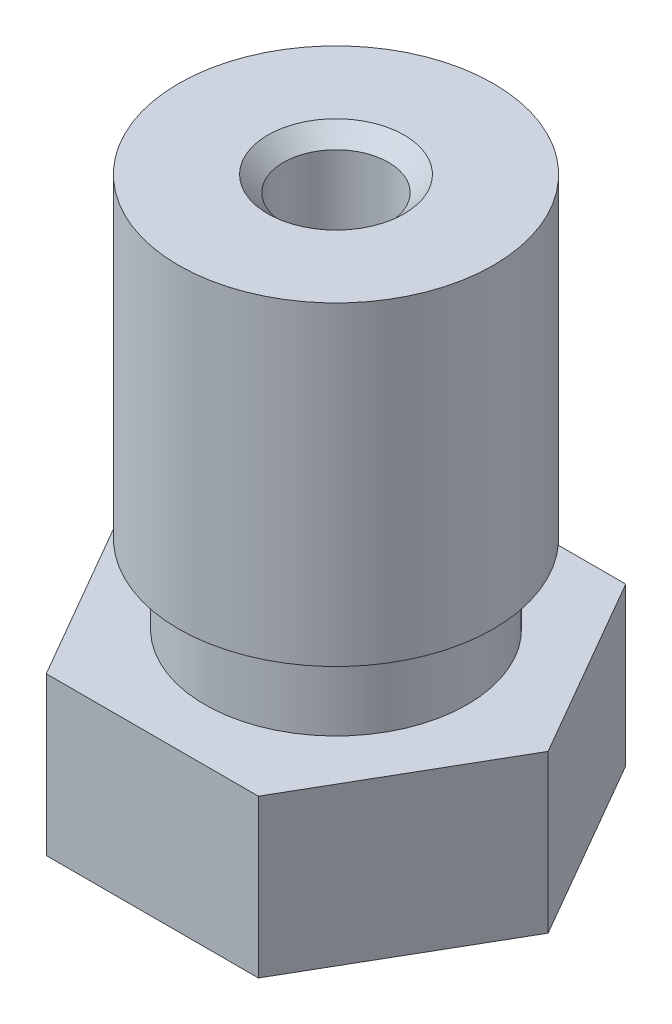
from build123d import *

# Parameters (mm, degrees)
BOSS_EXTRUDE1_START = -3
BOSS_EXTRUDE1_DEPTH = 3


with BuildPart() as part:
    # Sketch1 → Revolve1 (revolve)
    with BuildSketch(Plane.XY):
        Polygon((0, 0), (0.5, 0), (1.900415076, 2), (3.5, 2), (3.5, 5), (2.5, 5), (2.5, 6.5), (3, 6.5), (3, 12.5), (0, 12.5), align=None)
    revolve(axis=Axis((0, -1.1291331, 0), (0, -1, 0)))

    # Sketch2 → Cut-Revolve1 (revolve, cut)
    with BuildSketch(Plane.XY):
        Polygon((0, 12.5), (1.3, 12.5), (1, 12.2), (1, 1.985640646), (0.2, 0.6), (0.2, 0), (0, 0), align=None)
    revolve(axis=Axis((0, 0, 0), (0, 1, 0)), mode=Mode.SUBTRACT)

    # Sketch3 → Boss-Extrude1 (add)
    with BuildSketch(Plane.XZ.offset(-2).offset(BOSS_EXTRUDE1_START)):
        with BuildLine():
            Line((3.031088915, -1.749999996), (4.041451884, 0))
            Line((4.041451884, 0), (3.031088922, 1.749999985))
            ThreePointArc((3.031088922, 1.749999985), (3.5, -6e-09), (3.031088915, -1.749999996))
        make_face()
        with BuildLine():
            ThreePointArc((0, 3.5), (1.750000007, 3.031088909), (3.031088922, 1.749999985))
            Line((3.031088922, 1.749999985), (2.020725942, 3.5))
            Line((2.020725942, 3.5), (0, 3.5))
        make_face()
        with BuildLine():
            Line((2.020725942, -3.5), (3.031088915, -1.749999996))
            ThreePointArc((3.031088915, -1.749999996), (1.750000009, -3.031088908), (1.6e-08, -3.5))
            Line((1.6e-08, -3.5), (2.020725942, -3.5))
        make_face()
        with BuildLine():
            ThreePointArc((-3.031088921, 1.749999986), (-1.750000007, 3.031088909), (0, 3.5))
            Line((0, 3.5), (-2.020725942, 3.5))
            Line((-2.020725942, 3.5), (-3.031088921, 1.749999986))
        make_face()
        with BuildLine():
            Line((-2.020725942, -3.5), (1.6e-08, -3.5))
            ThreePointArc((1.6e-08, -3.5), (-1.75, -3.031088913), (-3.031088921, -1.749999986))
            Line((-3.031088921, -1.749999986), (-2.020725942, -3.5))
        make_face()
        with BuildLine():
            ThreePointArc((-3.031088921, -1.749999986), (-3.5, 0), (-3.031088921, 1.749999986))
            Line((-3.031088921, 1.749999986), (-4.041451884, 0))
            Line((-4.041451884, 0), (-3.031088921, -1.749999986))
        make_face()
    extrude(amount=BOSS_EXTRUDE1_DEPTH)


solid = part.part
